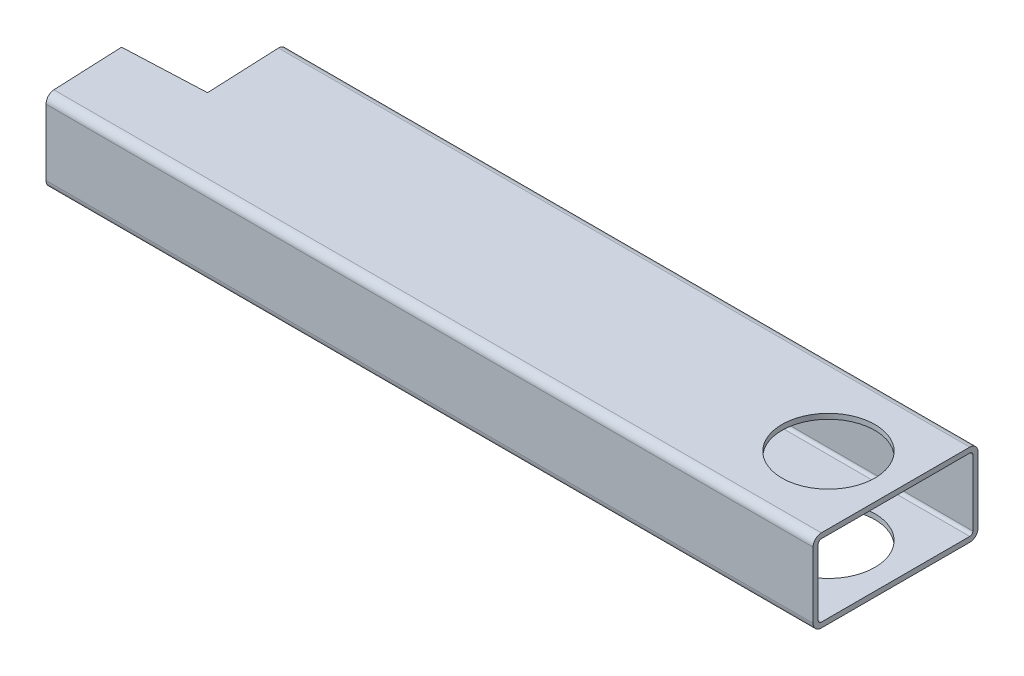
from build123d import *

# Parameters (mm, degrees)
EXTRUDE_THIN1_DEPTH     = 243.6368
CUT_EXTRUDE1_DEPTH      = 251.169323288
CUT_EXTRUDE1_DEPTH_BACK = 251.169323288
SKETCH4_R               = 14.3129


with BuildPart() as part:
    # Sketch1 → Extrude-Thin1 (new body)
    with BuildSketch(Plane(origin=(0, 0, 0), x_dir=(0, 0, -1), z_dir=(1, 0, 0))):
        with BuildLine():
            Line((-48.26, 25.4), (-2.54, 25.4))
            ThreePointArc((-2.54, 25.4), (-0.743948776, 24.656051224), (0, 22.86))
            Line((0, 22.86), (0, 2.54))
            ThreePointArc((0, 2.54), (-0.743948776, 0.743948776), (-2.54, 0))
            Line((-2.54, 0), (-48.26, 0))
            ThreePointArc((-48.26, 0), (-50.056051224, 0.743948776), (-50.8, 2.54))
            Line((-50.8, 2.54), (-50.8, 22.86))
            ThreePointArc((-50.8, 22.86), (-50.056051224, 24.656051224), (-48.26, 25.4))
        make_face()
        with BuildLine():
            Line((-48.26, 23.8125), (-2.54, 23.8125))
            ThreePointArc((-2.54, 23.8125), (-1.866480791, 23.533519209), (-1.5875, 22.86))
            Line((-1.5875, 22.86), (-1.5875, 2.54))
            ThreePointArc((-1.5875, 2.54), (-1.866480791, 1.866480791), (-2.54, 1.5875))
            Line((-2.54, 1.5875), (-48.26, 1.5875))
            ThreePointArc((-48.26, 1.5875), (-48.933519209, 1.866480791), (-49.2125, 2.54))
            Line((-49.2125, 2.54), (-49.2125, 22.86))
            ThreePointArc((-49.2125, 22.86), (-48.933519209, 23.533519209), (-48.26, 23.8125))
        make_face(mode=Mode.SUBTRACT)
    extrude(amount=-EXTRUDE_THIN1_DEPTH)

    # Sketch4 → Cut-Extrude1 (cut, two sides: drawn at the far end of the back side and taken through both)
    with BuildSketch(Plane(origin=(0, 25.4, 0), x_dir=(1, 0, 0), z_dir=(0, 1, 0)).offset(-CUT_EXTRUDE1_DEPTH_BACK)):
        with Locations((-20.6629, -25.4)):
            Circle(SKETCH4_R)
        Polygon((-213.01144117, 0), (-211.916323629, -25.376381097), (-237.2868, -26.471243819), (-236.236892705, -50.8), (-243.6368, -50.8), (-243.6368, -26.745278023), (-243.6368, 0), align=None)
    extrude(amount=CUT_EXTRUDE1_DEPTH + CUT_EXTRUDE1_DEPTH_BACK, mode=Mode.SUBTRACT)


solid = part.part
